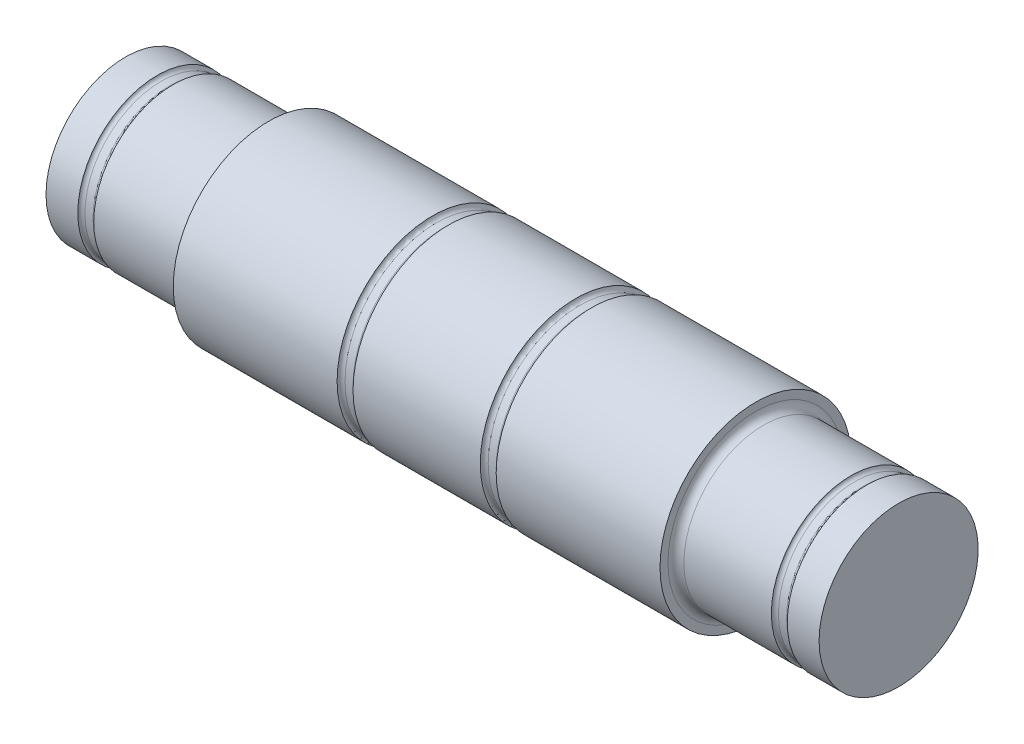
from build123d import *

# Parameters (mm, degrees)
FILLET1_R   = 0.25
FILLET1_R_2 = 0.5


with BuildPart() as part:
    # Sketch1 → Revolve1 (revolve)
    with BuildSketch(Plane.XY, mode=Mode.PRIVATE) as revolve1_sk:
        Polygon((-24.3, 0), (24.3, 0), (24.3, 5), (22.3, 5), (22.3, 4.8), (21.3, 4.8), (21.3, 5), (15.3, 5), (15.3, 6), (5, 6), (5, 5.75), (4, 5.75), (4, 6), (-4, 6), (-4, 5.75), (-5, 5.75), (-5, 6), (-15.3, 6), (-15.3, 5), (-21.3, 5), (-21.3, 4.8), (-22.3, 4.8), (-22.3, 5), (-24.3, 5), align=None)
    revolve(revolve1_sk.sketch.rotate(Axis((-24.3, 0, 0), (1, 0, 0)), 90), axis=Axis((-24.3, 0, 0), (1, 0, 0)))

    # Fillet1
    # the kernel refuses this fillet: 0.5, 0.25 mm, written as the material it adds along each edge
    with BuildSketch(Plane(origin=(-22.3, 0, 0), x_dir=(0, 0, 1), z_dir=(0, 1, 0))) as fillet1_piece_1:
        with BuildLine():
            CenterArc((5.05, 0.244948974), FILLET1_R, 180, 78.463040967)
            Line((5, 0), (4.999, -0.004898979))
            ThreePointArc((4.999, -0.004898979), (4.9, -0.005), (4.8, -0.005))
            Line((4.8, -0.005), (4.795, 0))
            Line((4.795, 0), (4.795, 0.244948974))
            Line((4.795, 0.244948974), (4.8, 0.244948974))
        make_face()
    revolve(axis=Axis((-22.3, 0, 0), (1, 0, 0)))
    with BuildSketch(Plane(origin=(-21.3, 0, 0), x_dir=(0, 0, 1), z_dir=(0, 1, 0))) as fillet1_piece_2:
        with BuildLine():
            CenterArc((5.05, -0.244948974), FILLET1_R, 101.536959033, 78.463040967)
            Line((4.8, -0.244948974), (4.795, -0.244948974))
            Line((4.795, -0.244948974), (4.795, 0))
            Line((4.795, 0), (4.8, 0.005))
            ThreePointArc((4.8, 0.005), (4.9, 0.005), (4.999, 0.004898979))
            Line((4.999, 0.004898979), (5, 0))
        make_face()
    revolve(axis=Axis((-21.3, 0, 0), (1, 0, 0)))
    with BuildSketch(Plane(origin=(21.3, 0, 0), x_dir=(0, 0, 1), z_dir=(0, 1, 0))) as fillet1_piece_3:
        with BuildLine():
            CenterArc((5.05, 0.244948974), FILLET1_R, 180, 78.463040967)
            Line((5, 0), (4.999, -0.004898979))
            ThreePointArc((4.999, -0.004898979), (4.9, -0.005), (4.8, -0.005))
            Line((4.8, -0.005), (4.795, 0))
            Line((4.795, 0), (4.795, 0.244948974))
            Line((4.795, 0.244948974), (4.8, 0.244948974))
        make_face()
    revolve(axis=Axis((21.3, 0, 0), (1, 0, 0)))
    with BuildSketch(Plane(origin=(22.3, 0, 0), x_dir=(0, 0, 1), z_dir=(0, 1, 0))) as fillet1_piece_4:
        with BuildLine():
            CenterArc((5.05, -0.244948974), FILLET1_R, 101.536959033, 78.463040967)
            Line((4.8, -0.244948974), (4.795, -0.244948974))
            Line((4.795, -0.244948974), (4.795, 0))
            Line((4.795, 0), (4.8, 0.005))
            ThreePointArc((4.8, 0.005), (4.9, 0.005), (4.999, 0.004898979))
            Line((4.999, 0.004898979), (5, 0))
        make_face()
    revolve(axis=Axis((22.3, 0, 0), (1, 0, 0)))
    with BuildSketch(Plane(origin=(5, 0, 0), x_dir=(0, 0, 1), z_dir=(0, 1, 0))) as fillet1_piece_5:
        with BuildLine():
            CenterArc((5.75 + FILLET1_R, -FILLET1_R), FILLET1_R, 90, 90)
            Line((5.75, -FILLET1_R), (5.75 - FILLET1_R * 0.02, -FILLET1_R))
            Line((5.75 - FILLET1_R * 0.02, -FILLET1_R), (5.75 - FILLET1_R * 0.02, FILLET1_R * 0.02))
            Line((5.75 - FILLET1_R * 0.02, FILLET1_R * 0.02), (5.75 + FILLET1_R, FILLET1_R * 0.02))
            Line((5.75 + FILLET1_R, FILLET1_R * 0.02), (5.75 + FILLET1_R, 0))
        make_face()
    revolve(axis=Axis((5, 0, 0), (1, 0, 0)))
    with BuildSketch(Plane(origin=(4, 0, 0), x_dir=(0, 0, 1), z_dir=(0, 1, 0))) as fillet1_piece_6:
        with BuildLine():
            CenterArc((5.75 + FILLET1_R, FILLET1_R), FILLET1_R, 180, 90)
            Line((5.75 + FILLET1_R, 0), (5.75 + FILLET1_R, -FILLET1_R * 0.02))
            Line((5.75 + FILLET1_R, -FILLET1_R * 0.02), (5.75 - FILLET1_R * 0.02, -FILLET1_R * 0.02))
            Line((5.75 - FILLET1_R * 0.02, -FILLET1_R * 0.02), (5.75 - FILLET1_R * 0.02, FILLET1_R))
            Line((5.75 - FILLET1_R * 0.02, FILLET1_R), (5.75, FILLET1_R))
        make_face()
    revolve(axis=Axis((4, 0, 0), (1, 0, 0)))
    with BuildSketch(Plane(origin=(-5, 0, 0), x_dir=(0, 0, 1), z_dir=(0, 1, 0))) as fillet1_piece_7:
        with BuildLine():
            CenterArc((5.75 + FILLET1_R, FILLET1_R), FILLET1_R, 180, 90)
            Line((5.75 + FILLET1_R, 0), (5.75 + FILLET1_R, -FILLET1_R * 0.02))
            Line((5.75 + FILLET1_R, -FILLET1_R * 0.02), (5.75 - FILLET1_R * 0.02, -FILLET1_R * 0.02))
            Line((5.75 - FILLET1_R * 0.02, -FILLET1_R * 0.02), (5.75 - FILLET1_R * 0.02, FILLET1_R))
            Line((5.75 - FILLET1_R * 0.02, FILLET1_R), (5.75, FILLET1_R))
        make_face()
    revolve(axis=Axis((-5, 0, 0), (1, 0, 0)))
    with BuildSketch(Plane(origin=(-4, 0, 0), x_dir=(0, 0, 1), z_dir=(0, 1, 0))) as fillet1_piece_8:
        with BuildLine():
            CenterArc((5.75 + FILLET1_R, -FILLET1_R), FILLET1_R, 90, 90)
            Line((5.75, -FILLET1_R), (5.75 - FILLET1_R * 0.02, -FILLET1_R))
            Line((5.75 - FILLET1_R * 0.02, -FILLET1_R), (5.75 - FILLET1_R * 0.02, FILLET1_R * 0.02))
            Line((5.75 - FILLET1_R * 0.02, FILLET1_R * 0.02), (5.75 + FILLET1_R, FILLET1_R * 0.02))
            Line((5.75 + FILLET1_R, FILLET1_R * 0.02), (5.75 + FILLET1_R, 0))
        make_face()
    revolve(axis=Axis((-4, 0, 0), (1, 0, 0)))
    with BuildSketch(Plane(origin=(-15.3, 0, 0), x_dir=(0, 0, 1), z_dir=(0, 1, 0))) as fillet1_piece_9:
        with BuildLine():
            CenterArc((5 + FILLET1_R_2, -FILLET1_R_2), FILLET1_R_2, 90, 90)
            Line((5, -FILLET1_R_2), (5 - FILLET1_R_2 * 0.02, -FILLET1_R_2))
            Line((5 - FILLET1_R_2 * 0.02, -FILLET1_R_2), (5 - FILLET1_R_2 * 0.02, FILLET1_R_2 * 0.02))
            Line((5 - FILLET1_R_2 * 0.02, FILLET1_R_2 * 0.02), (5 + FILLET1_R_2, FILLET1_R_2 * 0.02))
            Line((5 + FILLET1_R_2, FILLET1_R_2 * 0.02), (5 + FILLET1_R_2, 0))
        make_face()
    revolve(axis=Axis((-15.3, 0, 0), (1, 0, 0)))
    with BuildSketch(Plane(origin=(15.3, 0, 0), x_dir=(0, 0, 1), z_dir=(0, 1, 0))) as fillet1_piece_10:
        with BuildLine():
            CenterArc((5 + FILLET1_R_2, FILLET1_R_2), FILLET1_R_2, 180, 90)
            Line((5 + FILLET1_R_2, 0), (5 + FILLET1_R_2, -FILLET1_R_2 * 0.02))
            Line((5 + FILLET1_R_2, -FILLET1_R_2 * 0.02), (5 - FILLET1_R_2 * 0.02, -FILLET1_R_2 * 0.02))
            Line((5 - FILLET1_R_2 * 0.02, -FILLET1_R_2 * 0.02), (5 - FILLET1_R_2 * 0.02, FILLET1_R_2))
            Line((5 - FILLET1_R_2 * 0.02, FILLET1_R_2), (5, FILLET1_R_2))
        make_face()
    revolve(axis=Axis((15.3, 0, 0), (1, 0, 0)))


solid = part.part
